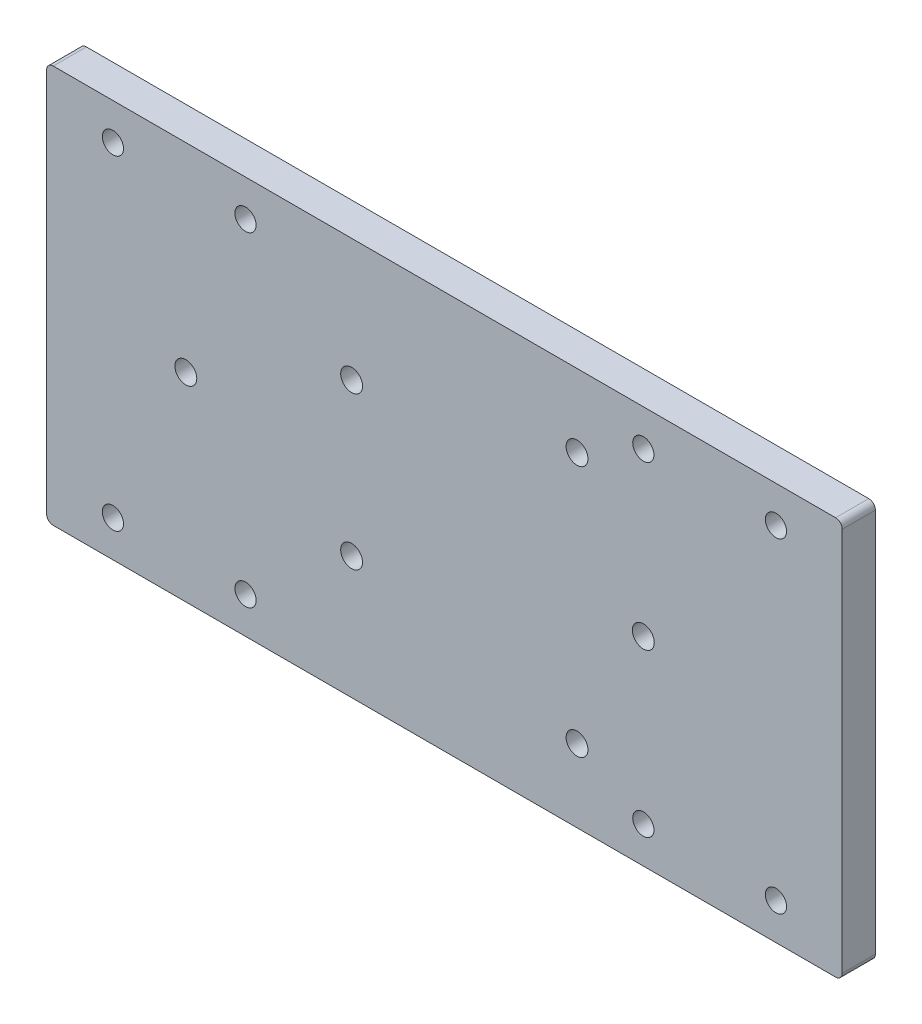
from build123d import *

# Parameters (mm, degrees)
SKETCH_1_W          = 120
SKETCH_1_H          = 60
EXTRUDE_1_DEPTH     = 5
CUT_EXTRUDE_1_REACH = 115.997
SKETCH_2_R          = 1.65
CUT_EXTRUDE_2_REACH = 115.997
SKETCH_4_R          = 1.6
CUT_EXTRUDE_3_REACH = 115.997
SKETCH_5_R          = 1.65
FILLET_1_R          = 1


with BuildPart() as part:
    # 草图1 → 凸台-拉伸1 (new body)
    with BuildSketch(Plane.XY):
        with Locations((-40, -24.5)):
            Rectangle(SKETCH_1_W, SKETCH_1_H)
    extrude(amount=EXTRUDE_1_DEPTH)

    # 草图2 → 切除-拉伸1 (cut, up to next)
    with BuildSketch(Plane.XY.offset(5), mode=Mode.PRIVATE) as cut_extrude_1_sk1:
        with Locations((-54, -13)):
            Circle(SKETCH_2_R)
    cut_extrude_1_tool1 = extrude(cut_extrude_1_sk1.sketch, amount=-CUT_EXTRUDE_1_REACH, mode=Mode.PRIVATE) & part.part
    # 草图2 → 切除-拉伸1 (cut, up to next)
    with BuildSketch(Plane.XY.offset(5), mode=Mode.PRIVATE) as cut_extrude_1_sk2:
        with Locations((-79, -24.5)):
            Circle(SKETCH_2_R)
    cut_extrude_1_tool2 = extrude(cut_extrude_1_sk2.sketch, amount=-CUT_EXTRUDE_1_REACH, mode=Mode.PRIVATE) & part.part
    # 草图2 → 切除-拉伸1 (cut, up to next)
    with BuildSketch(Plane.XY.offset(5), mode=Mode.PRIVATE) as cut_extrude_1_sk3:
        with Locations((-54, -36)):
            Circle(SKETCH_2_R)
    cut_extrude_1_tool3 = extrude(cut_extrude_1_sk3.sketch, amount=-CUT_EXTRUDE_1_REACH, mode=Mode.PRIVATE) & part.part
    add(cut_extrude_1_tool1.solids().sort_by_distance((-54, -13, 5))[0], mode=Mode.SUBTRACT)
    add(cut_extrude_1_tool2.solids().sort_by_distance((-79, -24.5, 5))[0], mode=Mode.SUBTRACT)
    add(cut_extrude_1_tool3.solids().sort_by_distance((-54, -36, 5))[0], mode=Mode.SUBTRACT)

    # 草图4 → 切除-拉伸2 (cut, up to next)
    with BuildSketch(Plane(origin=(0, 0, 0), x_dir=(-1, 0, 0), z_dir=(0, 0, -1)), mode=Mode.PRIVATE) as cut_extrude_2_sk1:
        with Locations((90, 0)):
            Circle(SKETCH_4_R)
    cut_extrude_2_tool1 = extrude(cut_extrude_2_sk1.sketch, amount=-CUT_EXTRUDE_2_REACH, mode=Mode.PRIVATE) & part.part
    # 草图4 → 切除-拉伸2 (cut, up to next)
    with BuildSketch(Plane(origin=(0, 0, 0), x_dir=(-1, 0, 0), z_dir=(0, 0, -1)), mode=Mode.PRIVATE) as cut_extrude_2_sk2:
        with Locations((70, 0)):
            Circle(SKETCH_4_R)
    cut_extrude_2_tool2 = extrude(cut_extrude_2_sk2.sketch, amount=-CUT_EXTRUDE_2_REACH, mode=Mode.PRIVATE) & part.part
    # 草图4 → 切除-拉伸2 (cut, up to next)
    with BuildSketch(Plane(origin=(0, 0, 0), x_dir=(-1, 0, 0), z_dir=(0, 0, -1)), mode=Mode.PRIVATE) as cut_extrude_2_sk3:
        with Locations((70, -49)):
            Circle(SKETCH_4_R)
    cut_extrude_2_tool3 = extrude(cut_extrude_2_sk3.sketch, amount=-CUT_EXTRUDE_2_REACH, mode=Mode.PRIVATE) & part.part
    # 草图4 → 切除-拉伸2 (cut, up to next)
    with BuildSketch(Plane(origin=(0, 0, 0), x_dir=(-1, 0, 0), z_dir=(0, 0, -1)), mode=Mode.PRIVATE) as cut_extrude_2_sk4:
        with Locations((90, -49)):
            Circle(SKETCH_4_R)
    cut_extrude_2_tool4 = extrude(cut_extrude_2_sk4.sketch, amount=-CUT_EXTRUDE_2_REACH, mode=Mode.PRIVATE) & part.part
    # 草图4 → 切除-拉伸2 (cut, up to next)
    with BuildSketch(Plane(origin=(0, 0, 0), x_dir=(-1, 0, 0), z_dir=(0, 0, -1)), mode=Mode.PRIVATE) as cut_extrude_2_sk5:
        with Locations((10, -49)):
            Circle(SKETCH_4_R)
    cut_extrude_2_tool5 = extrude(cut_extrude_2_sk5.sketch, amount=-CUT_EXTRUDE_2_REACH, mode=Mode.PRIVATE) & part.part
    # 草图4 → 切除-拉伸2 (cut, up to next)
    with BuildSketch(Plane(origin=(0, 0, 0), x_dir=(-1, 0, 0), z_dir=(0, 0, -1)), mode=Mode.PRIVATE) as cut_extrude_2_sk6:
        with Locations((-10, -49)):
            Circle(SKETCH_4_R)
    cut_extrude_2_tool6 = extrude(cut_extrude_2_sk6.sketch, amount=-CUT_EXTRUDE_2_REACH, mode=Mode.PRIVATE) & part.part
    # 草图4 → 切除-拉伸2 (cut, up to next)
    with BuildSketch(Plane(origin=(0, 0, 0), x_dir=(-1, 0, 0), z_dir=(0, 0, -1)), mode=Mode.PRIVATE) as cut_extrude_2_sk7:
        with Locations((-10, 0)):
            Circle(SKETCH_4_R)
    cut_extrude_2_tool7 = extrude(cut_extrude_2_sk7.sketch, amount=-CUT_EXTRUDE_2_REACH, mode=Mode.PRIVATE) & part.part
    # 草图4 → 切除-拉伸2 (cut, up to next)
    with BuildSketch(Plane(origin=(0, 0, 0), x_dir=(-1, 0, 0), z_dir=(0, 0, -1)), mode=Mode.PRIVATE) as cut_extrude_2_sk8:
        with Locations((10, 0)):
            Circle(SKETCH_4_R)
    cut_extrude_2_tool8 = extrude(cut_extrude_2_sk8.sketch, amount=-CUT_EXTRUDE_2_REACH, mode=Mode.PRIVATE) & part.part
    add(cut_extrude_2_tool1.solids().sort_by_distance((-90, 0, 0))[0], mode=Mode.SUBTRACT)
    add(cut_extrude_2_tool2.solids().sort_by_distance((-70, 0, 0))[0], mode=Mode.SUBTRACT)
    add(cut_extrude_2_tool3.solids().sort_by_distance((-70, -49, 0))[0], mode=Mode.SUBTRACT)
    add(cut_extrude_2_tool4.solids().sort_by_distance((-90, -49, 0))[0], mode=Mode.SUBTRACT)
    add(cut_extrude_2_tool5.solids().sort_by_distance((-10, -49, 0))[0], mode=Mode.SUBTRACT)
    add(cut_extrude_2_tool6.solids().sort_by_distance((10, -49, 0))[0], mode=Mode.SUBTRACT)
    add(cut_extrude_2_tool7.solids().sort_by_distance((10, 0, 0))[0], mode=Mode.SUBTRACT)
    add(cut_extrude_2_tool8.solids().sort_by_distance((-10, 0, 0))[0], mode=Mode.SUBTRACT)

    # 草图5 → 切除-拉伸3 (cut, up to next)
    with BuildSketch(Plane.XY.offset(5), mode=Mode.PRIVATE) as cut_extrude_3_sk1:
        with Locations((-20, -43.5)):
            Circle(SKETCH_5_R)
    cut_extrude_3_tool1 = extrude(cut_extrude_3_sk1.sketch, amount=-CUT_EXTRUDE_3_REACH, mode=Mode.PRIVATE) & part.part
    # 草图5 → 切除-拉伸3 (cut, up to next)
    with BuildSketch(Plane.XY.offset(5), mode=Mode.PRIVATE) as cut_extrude_3_sk2:
        with Locations((-10, -24.5)):
            Circle(SKETCH_5_R)
    cut_extrude_3_tool2 = extrude(cut_extrude_3_sk2.sketch, amount=-CUT_EXTRUDE_3_REACH, mode=Mode.PRIVATE) & part.part
    # 草图5 → 切除-拉伸3 (cut, up to next)
    with BuildSketch(Plane.XY.offset(5), mode=Mode.PRIVATE) as cut_extrude_3_sk3:
        with Locations((-20, -5.5)):
            Circle(SKETCH_5_R)
    cut_extrude_3_tool3 = extrude(cut_extrude_3_sk3.sketch, amount=-CUT_EXTRUDE_3_REACH, mode=Mode.PRIVATE) & part.part
    add(cut_extrude_3_tool1.solids().sort_by_distance((-20, -43.5, 5))[0], mode=Mode.SUBTRACT)
    add(cut_extrude_3_tool2.solids().sort_by_distance((-10, -24.5, 5))[0], mode=Mode.SUBTRACT)
    add(cut_extrude_3_tool3.solids().sort_by_distance((-20, -5.5, 5))[0], mode=Mode.SUBTRACT)

    # 圆角1
    fillet_1_edges = [part.edges().sort_by_distance(p)[0] for p in [
        (-100, -54.5, 2.5),
        (-100, 5.5, 2.5),
        (20, -54.5, 2.5),
        (20, 5.5, 2.5),
    ]]
    fillet(fillet_1_edges, radius=FILLET_1_R)


solid = part.part
